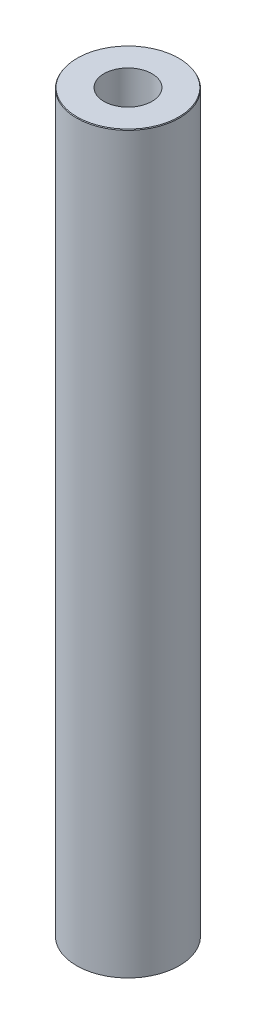
from build123d import *
from OCP.BRepFilletAPI import BRepFilletAPI_MakeChamfer

# Parameters (mm, degrees)
SKETCH1_R           = 35
BOSS_EXTRUDE1_DEPTH = 501.193904651
SKETCH2_R           = 16.38268321
CUT_EXTRUDE1_DEPTH  = 504.632137635
CHAMFER1_SIZE       = 0.556596885
CHAMFER1_SIZE2      = 0.321351361


with BuildPart() as part:
    # Sketch1 → Boss-Extrude1 (new body)
    with BuildSketch(Plane(origin=(0, 0, 0), x_dir=(1, 0, 0), z_dir=(0, 1, 0))):
        Circle(SKETCH1_R)
    extrude(amount=BOSS_EXTRUDE1_DEPTH)

    # Sketch2 → Cut-Extrude1 (cut, through all)
    with BuildSketch(Plane(origin=(0, 0, 0), x_dir=(1, 0, 0), z_dir=(0, 1, 0))):
        Circle(SKETCH2_R)
    extrude(amount=CUT_EXTRUDE1_DEPTH, mode=Mode.SUBTRACT)

    # Chamfer1: one chamfer whose edges measure the first distance from different faces: ONE call of the kernel's chamfer builder (chamfer() names one face for all edges)
    chamfer1_edges_1 = [part.edges().sort_by_distance(p)[0] for p in [
        (-35, 501.193904651, 0),
    ]]
    chamfer1_side_1 = [part.faces().sort_by_distance(p)[0] for p in [
        (-35, 250.596952325, 0),
    ]]
    chamfer1_edges_2 = [part.edges().sort_by_distance(p)[0] for p in [
        (-35, 0, 0),
    ]]
    chamfer1_side_2 = [part.faces().sort_by_distance(p)[0] for p in [
        (-34.010050506, 0, 0),
    ]]
    chamfer1 = BRepFilletAPI_MakeChamfer(part.part.solid().wrapped)
    for e in chamfer1_edges_1:
        chamfer1.Add(CHAMFER1_SIZE, CHAMFER1_SIZE2, e.wrapped, chamfer1_side_1[0].wrapped)  # the first distance lies on this face
    for e in chamfer1_edges_2:
        chamfer1.Add(CHAMFER1_SIZE, CHAMFER1_SIZE2, e.wrapped, chamfer1_side_2[0].wrapped)  # the first distance lies on this face
    add(Compound.cast(chamfer1.Shape()), mode=Mode.REPLACE)


solid = part.part
